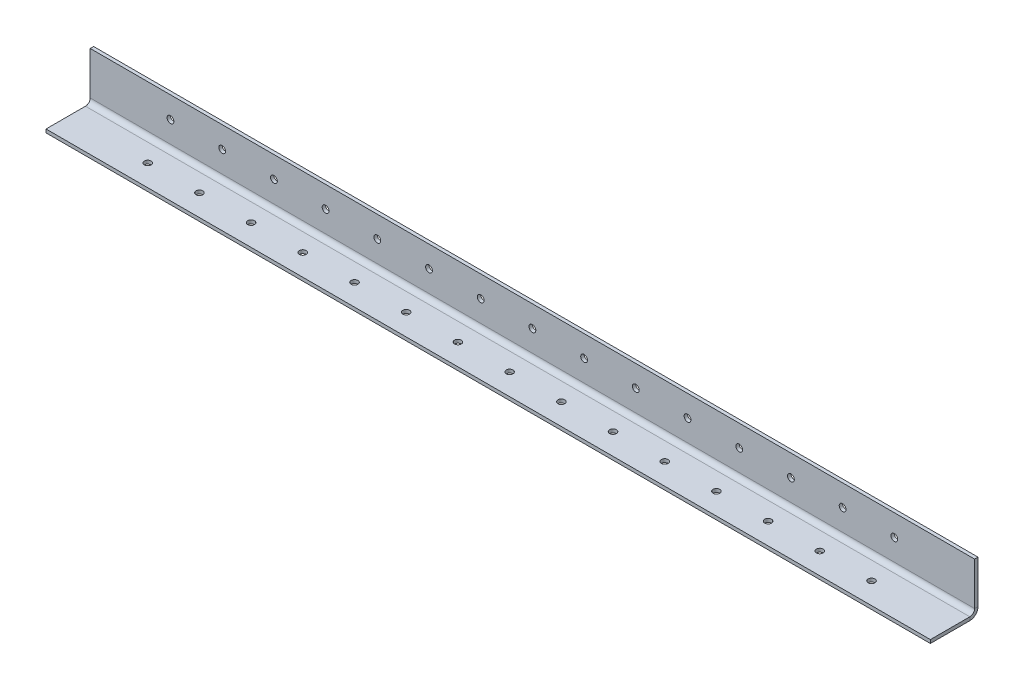
from build123d import *

# Parameters (mm, degrees)
SKETCH1_W                    = 2600
SKETCH1_H                    = 150
BASE_FLANGE1_DEPTH           = 10
EDGE_FLANGE1_STRIP_W         = 68
EDGE_FLANGE1_STRIP_H         = 10
EDGE_FLANGE1_STRIP_CUT_DEPTH = 2600
EDGE_FLANGE1_DEPTH           = 2600
SKETCH12_R                   = 10
CUT_EXTRUDE1_DEPTH           = 10
SKETCH13_R                   = 10
CUT_EXTRUDE2_DEPTH           = 10
LPATTERN1_COUNT              = 15
LPATTERN1_PITCH              = 152


# Sheet-metal steps are written as plain solids
with BuildPart() as part:
    # Sketch1 → Base-Flange1 (new body)
    with BuildSketch(Plane.XY):
        Rectangle(SKETCH1_W, SKETCH1_H)
    extrude(amount=-BASE_FLANGE1_DEPTH)

    # Edge-Flange1 strip (across the edge) → Edge-Flange1 strip cut (cut)
    with BuildSketch(Plane(origin=(-1300, -75, 0), x_dir=(0, 1, 0), z_dir=(1, 0, 0))):
        with Locations((-10, -5)):
            Rectangle(EDGE_FLANGE1_STRIP_W, EDGE_FLANGE1_STRIP_H)
    extrude(amount=EDGE_FLANGE1_STRIP_CUT_DEPTH, mode=Mode.SUBTRACT)

    # Edge-Flange1 section (across the edge) → Edge-Flange1 (add)
    with BuildSketch(Plane(origin=(-1300, -75, 0), x_dir=(0, 1, 0), z_dir=(1, 0, 0))):
        with BuildLine():
            Line((0, 14), (0, 130))
            Line((0, 130), (10, 130))
            Line((10, 130), (10, 14))
            ThreePointArc((10, 14), (14.100505063, 4.100505063), (24, 0))
            Line((24, 0), (24, -10))
            ThreePointArc((24, -10), (7.029437252, -2.970562748), (0, 14))
        make_face()
    extrude(amount=EDGE_FLANGE1_DEPTH)

    # Sketch12 → Cut-Extrude1 (cut)
    with BuildSketch(Plane(origin=(0, -75, 0), x_dir=(-1, 0, 0), z_dir=(0, -1, 0))):
        with Locations(Location((1064, -67, 0), (0, 0, 90))):
            Circle(SKETCH12_R)
    cut_extrude1 = extrude(amount=-CUT_EXTRUDE1_DEPTH, mode=Mode.SUBTRACT)

    # Sketch13 → Cut-Extrude2 (cut)
    with BuildSketch(Plane(origin=(0, 0, -10), x_dir=(-1, 0, 0), z_dir=(0, 0, -1))):
        with Locations((1064, 12)):
            Circle(SKETCH13_R)
    cut_extrude2 = extrude(amount=-CUT_EXTRUDE2_DEPTH, mode=Mode.SUBTRACT)

    # LPattern1: Cut-Extrude1, Cut-Extrude2 ×15
    with Locations(*[(i * LPATTERN1_PITCH, 0, 0) for i in range(1, LPATTERN1_COUNT)]):
        add(cut_extrude1, mode=Mode.SUBTRACT)
        add(cut_extrude2, mode=Mode.SUBTRACT)


solid = part.part
